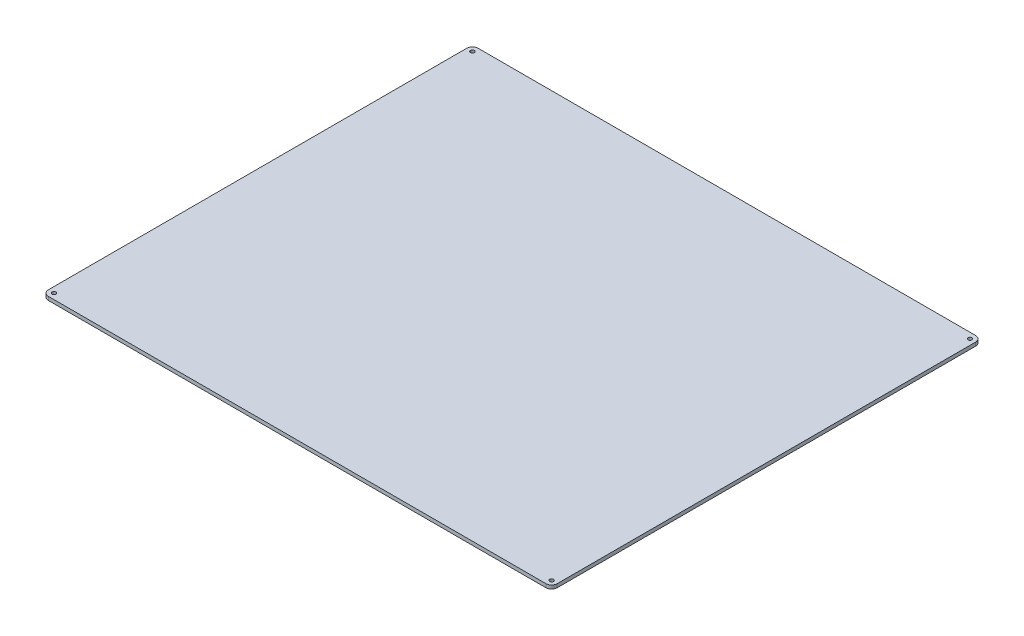
from build123d import *

# Parameters (mm, degrees)
SKETCH2_W            = 450
SKETCH2_H            = 380
BOSS_EXTRUDE1_DEPTH  = 3.175
M3_CLEARANCE_HOLE1_D = 3.4
FILLET1_R            = 5


with BuildPart() as part:
    # Sketch2 → Boss-Extrude1 (new body)
    with BuildSketch(Plane(origin=(0, 0, 0), x_dir=(1, 0, 0), z_dir=(0, 1, 0))):
        with Locations((225, 190)):
            Rectangle(SKETCH2_W, SKETCH2_H)
    extrude(amount=BOSS_EXTRUDE1_DEPTH)

    # M3 Clearance Hole1 (through all)
    with Locations(Plane(origin=(5, 3.175, -375), x_dir=(0, 0, 1), z_dir=(0, 1, 0))):
        with Locations((0, 0), (0, 440), (370, 0), (370, 440)):
            Hole(M3_CLEARANCE_HOLE1_D / 2)

    # Fillet1
    fillet1_edges = [part.edges().sort_by_distance(p)[0] for p in [
        (0, 1.5875, 0),
        (450, 1.5875, 0),
        (0, 1.5875, -380),
        (450, 1.5875, -380),
    ]]
    fillet(fillet1_edges, radius=FILLET1_R)


solid = part.part
